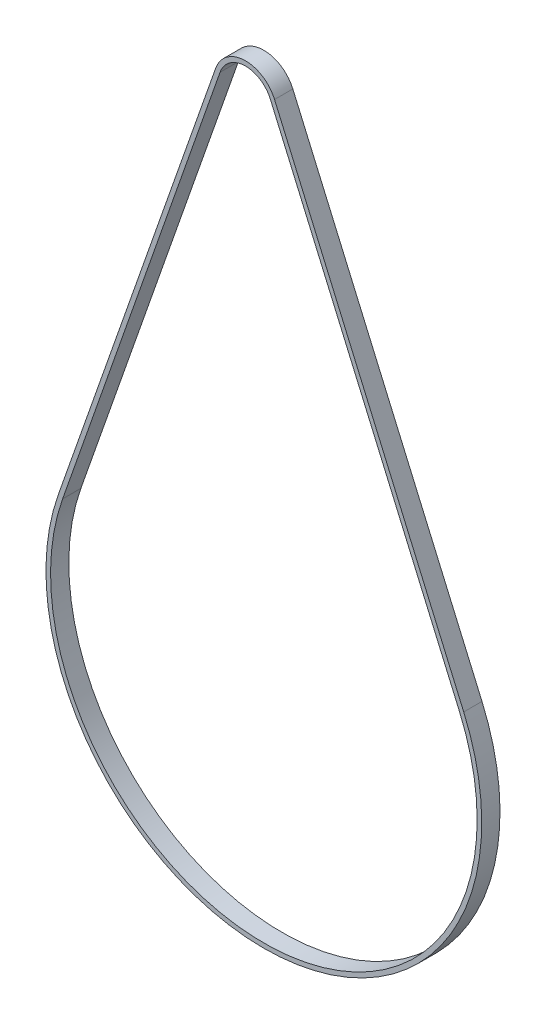
from build123d import *

# Parameters (mm, degrees)
EXTRUDE_THIN1_DEPTH = 6


with BuildPart() as part:
    # Sketch2 → Extrude-Thin1 (new body)
    with BuildSketch(Plane.XY):
        with BuildLine():
            Line((-12.244989183, 8.938905783), (49.831684613, -134.084847638))
            ThreePointArc((49.831684613, -134.084847638), (-13.195263171, -234.006371859), (-83.215472168, -138.854506498))
            Line((-83.215472168, -138.854506498), (-31.539618115, 8.247205186))
            ThreePointArc((-31.539618115, 8.247205186), (-22.12818615, 15.172875331), (-12.244989183, 8.938905783))
        make_face()
        with BuildLine():
            Line((-13.6209724, 8.341687075), (48.455701396, -134.682066347))
            ThreePointArc((48.455701396, -134.682066347), (-13.249002728, -232.507334814), (-81.800256292, -139.351662434))
            Line((-81.800256292, -139.351662434), (-30.124402239, 7.750049251))
            ThreePointArc((-30.124402239, 7.750049251), (-22.074446592, 13.673838287), (-13.6209724, 8.341687075))
        make_face(mode=Mode.SUBTRACT)
    extrude(amount=EXTRUDE_THIN1_DEPTH)


solid = part.part
